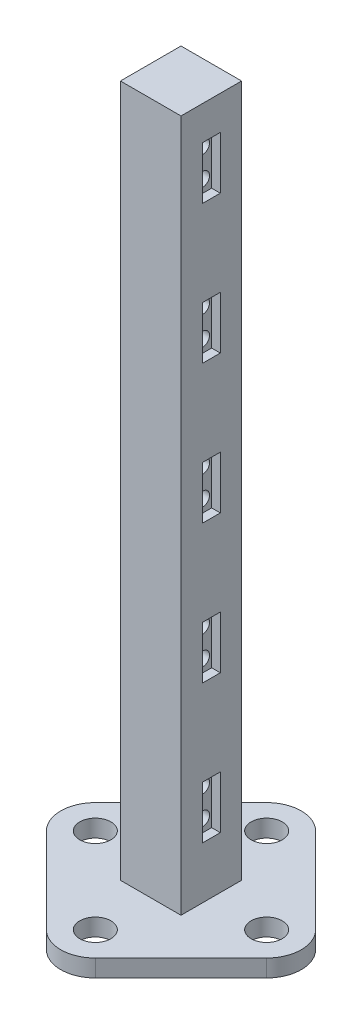
from build123d import *

# Parameters (mm, degrees)
SKETCH1_R             = 4.5
BOSS_EXTRUDE1_DEPTH   = 2.5
SKETCH2_W             = 17.5
SKETCH2_H             = 17.5
BOSS_EXTRUDE2_DEPTH   = 200
SKETCH3_W             = 5.2
SKETCH3_H             = 15.2
CUT_EXTRUDE1_DEPTH    = 2.5
F_4_0MM_DOWEL_HOLE1_D = 4
LPATTERN1_COUNT       = 5
LPATTERN1_PITCH       = 40


with BuildPart() as part:
    # Sketch1 → Boss-Extrude1 (new, symmetric)
    with BuildSketch(Plane(origin=(0, 0, 0), x_dir=(1, 0, 0), z_dir=(0, 1, 0))):
        with BuildLine():
            Line((-31.821067812, 7.071067812), (-7.071067812, 31.821067812))
            ThreePointArc((-7.071067812, 31.821067812), (0, 34.75), (7.071067812, 31.821067812))
            Line((7.071067812, 31.821067812), (31.821067812, 7.071067812))
            ThreePointArc((31.821067812, 7.071067812), (34.75, 0), (31.821067812, -7.071067812))
            Line((31.821067812, -7.071067812), (7.071067812, -31.821067812))
            ThreePointArc((7.071067812, -31.821067812), (0, -34.75), (-7.071067812, -31.821067812))
            Line((-7.071067812, -31.821067812), (-31.821067812, -7.071067812))
            ThreePointArc((-31.821067812, -7.071067812), (-34.75, 0), (-31.821067812, 7.071067812))
        make_face()
        with Locations((0, 24.75)):
            Circle(SKETCH1_R, mode=Mode.SUBTRACT)
        with Locations((24.75, 0)):
            Circle(SKETCH1_R, mode=Mode.SUBTRACT)
        with Locations((0, -24.75)):
            Circle(SKETCH1_R, mode=Mode.SUBTRACT)
        with Locations((-24.75, 0)):
            Circle(SKETCH1_R, mode=Mode.SUBTRACT)
    extrude(amount=BOSS_EXTRUDE1_DEPTH, both=True)

    # Sketch2 → Boss-Extrude2 (add)
    with BuildSketch(Plane(origin=(0, 2.5, 0), x_dir=(1, 0, 0), z_dir=(0, 1, 0))):
        Rectangle(SKETCH2_W, SKETCH2_H)
    extrude(amount=BOSS_EXTRUDE2_DEPTH)

    # Sketch3 → Cut-Extrude1 (cut)
    with BuildSketch(Plane(origin=(8.75, 0, 0), x_dir=(0, 0, -1), z_dir=(1, 0, 0))):
        with Locations((0, 25.1)):
            Rectangle(SKETCH3_W, SKETCH3_H)
    cut_extrude1 = extrude(amount=-CUT_EXTRUDE1_DEPTH, mode=Mode.SUBTRACT)

    # Ø4.0mm Dowel Hole1 (through all)
    with Locations(Plane(origin=(6.25, 0, 0), x_dir=(0, 0, -1), z_dir=(1, 0, 0))):
        with Locations((0, 21), (0, 29.2)):
            f_4_0mm_dowel_hole1 = Hole(F_4_0MM_DOWEL_HOLE1_D / 2)

    # LPattern1: Cut-Extrude1, Ø4.0mm Dowel Hole1 ×5
    with Locations(*[(0, i * LPATTERN1_PITCH, 0) for i in range(1, LPATTERN1_COUNT)]):
        add(cut_extrude1, mode=Mode.SUBTRACT)
        add(f_4_0mm_dowel_hole1, mode=Mode.SUBTRACT)


solid = part.part
